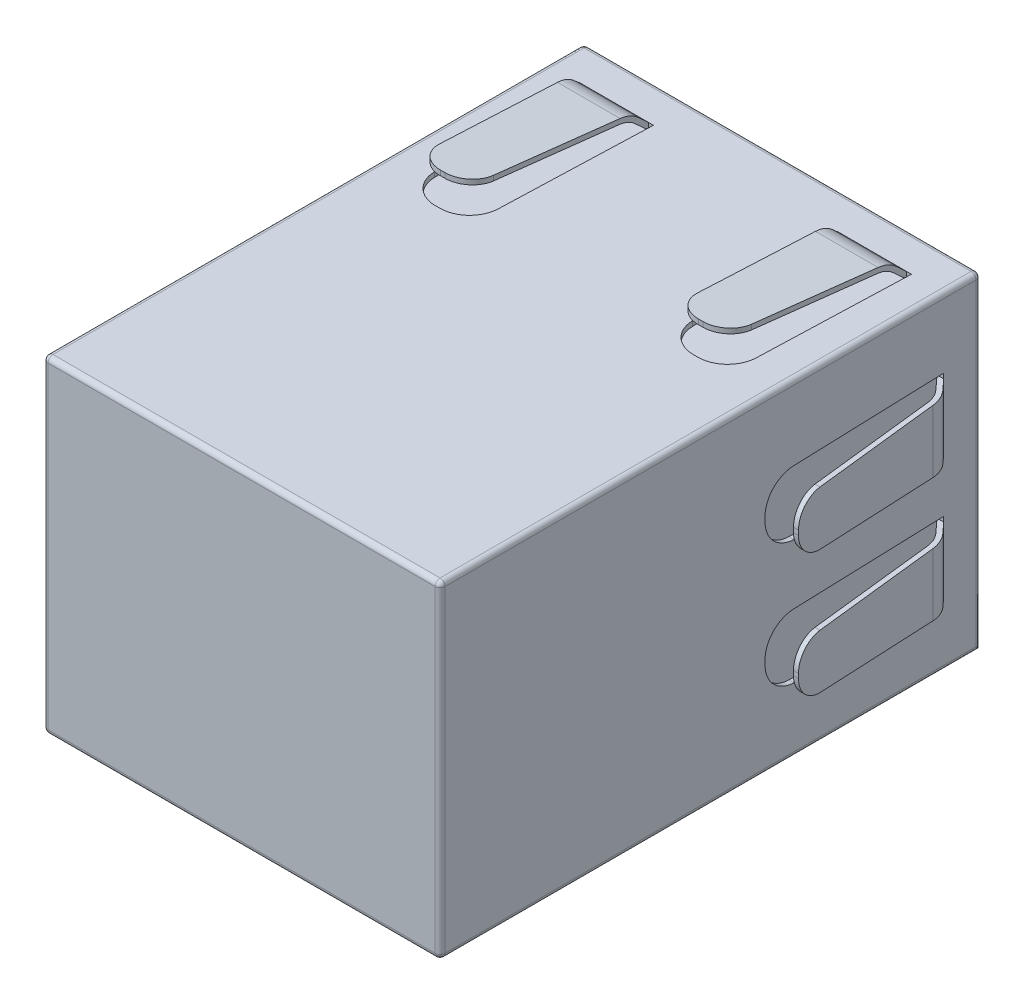
from build123d import *

# Parameters (mm, degrees)
CROQUIS1_W                 = 16
CROQUIS1_H                 = 13.2
EXTRUIR1_DEPTH             = 21.8
CORTAR_EXTRUIR1_DEPTH      = 0.2
CORTAR_EXTRUIR2_DEPTH      = 21.4
VACIADO1_START             = 0.2
VACIADO1_DEPTH             = 21.4
CROQUIS4_W                 = 0.2
CROQUIS4_H                 = 2
EXTRUIR2_DEPTH             = 3.2
CORTAR_EXTRUIR3_DEPTH      = 3.2
REDONDEO2_R                = 0.2
REDONDEO3_R                = 0.5
REDONDEO4_R                = 0.1
REDONDEO5_R                = 0.1
CROQUIS6_W                 = 0.509360806
CROQUIS6_H                 = 2.2
CORTAR_EXTRUIR4_DEPTH      = 3.2
CORTAR_EXTRUIR5_DEPTH      = 3.2
EXTRUIR3_DEPTH             = 3.2
EXTRUIR3_DEPTH_BACK        = 3.2
CORTAR_EXTRUIR6_DEPTH      = 3.2
CORTAR_EXTRUIR6_DEPTH_BACK = 3.2
CORTAR_EXTRUIR7_DEPTH      = 0.2
EXTRUIR4_DEPTH             = 3.2
EXTRUIR4_DEPTH_BACK        = 3.2
CORTAR_EXTRUIR8_DEPTH      = 3.2
CORTAR_EXTRUIR8_DEPTH_BACK = 3.2
MATRIZL1_COUNT             = 2
MATRIZL1_PITCH             = 5
EXTRUIR5_REACH             = 29.497
CROQUIS15_W                = 12.8
CROQUIS15_H                = 10.4
EXTRUIR6_DEPTH             = 9.6
CROQUIS16_W                = 3.295432671
CROQUIS16_H                = 2.190410628
EXTRUIR7_DEPTH             = 8.2
EXTRUIR8_DEPTH             = 4.2
EXTRUIR8_DEPTH_BACK        = 4.2
CROQUIS18_W                = 0.56
CROQUIS18_H                = 7.430160098
CORTAR_EXTRUIR9_DEPTH      = 23.2


# Read off the part's stored shape, not the designer's step: Vaciado1
with BuildPart() as part:
    # Croquis1 → Extruir1 (new body)
    with BuildSketch(Plane.XY):
        with Locations((0, 6.6)):
            Rectangle(CROQUIS1_W, CROQUIS1_H)
    extrude(amount=EXTRUIR1_DEPTH)

    # Croquis2 → Cortar-Extruir1 (cut)
    with BuildSketch(Plane(origin=(0, 0, 0), x_dir=(-1, 0, 0), z_dir=(0, 0, -1))):
        Polygon((-6.4, 10.6), (6.4, 10.6), (6.4, 1.6), (2.5, 1.6), (2.5, -0.56107677), (-2.5, -0.56107677), (-2.5, 1.6), (-6.4, 1.6), align=None)
    extrude(amount=-CORTAR_EXTRUIR1_DEPTH, mode=Mode.SUBTRACT)

    # Croquis3 → Cortar-Extruir2 (cut)
    with BuildSketch(Plane(origin=(0, 0, 0.2), x_dir=(-1, 0, 0), z_dir=(0, 0, -1))):
        Polygon((-2.5, 0.2), (2.5, 0.2), (2.5, 1.6), (6.4, 1.6), (6.4, 10.6), (-6.4, 10.6), (-6.4, 1.6), (-2.5, 1.6), align=None)
    extrude(amount=-CORTAR_EXTRUIR2_DEPTH, mode=Mode.SUBTRACT)

    # Vaciado1 outline → Vaciado1 (cut)
    with BuildSketch(Plane.XY.offset(VACIADO1_START)):
        Polygon((-7.8, 13), (-7.8, 0.2), (-2.5, 0.2), (-2.5, 1.6), (-6.4, 1.6), (-6.4, 10.6), (6.4, 10.6), (6.4, 1.6), (2.5, 1.6), (2.5, 0.2), (7.8, 0.2), (7.8, 13), align=None)
    extrude(amount=VACIADO1_DEPTH, mode=Mode.SUBTRACT)

    # Croquis5 → Cortar-Extruir3 (cut)
    with BuildSketch(Plane(origin=(0, 0, 0), x_dir=(-1, 0, 0), z_dir=(0, 0, -1))):
        with BuildLine():
            Line((-6.459745846, 8.353925027), (-6.316002889, 8.353925027))
            Line((-6.316002889, 8.353925027), (-6.316002889, 8.2))
            Line((-6.316002889, 8.2), (-6.459745846, 8.2))
            ThreePointArc((-6.459745846, 8.2), (-6.536708359, 8.276962513), (-6.459745846, 8.353925027))
        make_face()
        with BuildLine():
            Line((-6.316002889, 6.2), (-6.459745846, 6.2))
            ThreePointArc((-6.459745846, 6.2), (-6.536708359, 6.123037487), (-6.459745846, 6.046074973))
            Line((-6.459745846, 6.046074973), (-6.316002889, 6.046074973))
            Line((-6.316002889, 6.046074973), (-6.316002889, 6.2))
        make_face()
        with BuildLine():
            Line((6.459745846, 6.046074973), (6.316002889, 6.046074973))
            Line((6.316002889, 6.046074973), (6.316002889, 6.2))
            Line((6.316002889, 6.2), (6.459745846, 6.2))
            ThreePointArc((6.459745846, 6.2), (6.536708359, 6.123037487), (6.459745846, 6.046074973))
        make_face()
        with BuildLine():
            Line((6.316002889, 8.2), (6.459745846, 8.2))
            ThreePointArc((6.459745846, 8.2), (6.536708359, 8.276962513), (6.459745846, 8.353925027))
            Line((6.459745846, 8.353925027), (6.316002889, 8.353925027))
            Line((6.316002889, 8.353925027), (6.316002889, 8.2))
        make_face()
    extrude(amount=-CORTAR_EXTRUIR3_DEPTH, mode=Mode.SUBTRACT)


with BuildPart() as body_2:
    # Croquis4 → Extruir2 (new body)
    with BuildSketch(Plane(origin=(0, 0, 0), x_dir=(-1, 0, 0), z_dir=(0, 0, -1))):
        with Locations((-6.5, 7.2)):
            Rectangle(CROQUIS4_W, CROQUIS4_H)
    extrude(amount=-EXTRUIR2_DEPTH)


with BuildPart() as body_3:
    # Simetría1: mirrored copy
    add(body_2.part.mirror(Plane(origin=(0, 0, 0), x_dir=(0, 0, 1), z_dir=(1, 0, 0))))


with BuildPart() as part_1:
    add(part.part)

    # Combinar1: union body 2, body 3
    add(body_2.part)
    add(body_3.part)

    # Redondeo2
    redondeo2_edges = [part_1.edges().sort_by_distance(p)[0] for p in [
        (8, 6.6, 21.8),
        (0, 13.2, 21.8),
        (-8, 6.6, 21.8),
        (0, 13.2, 0),
        (8, 6.6, 0),
        (-8, 6.6, 0),
        (0, 0, 21.8),
        (-8, 13.2, 10.9),
        (8, 13.2, 10.9),
        (8, 0, 10.9),
        (-8, 0, 10.9),
    ]]
    fillet(redondeo2_edges, radius=REDONDEO2_R)

    # Redondeo3
    redondeo3_edges = [part_1.edges().sort_by_distance(p)[0] for p in [
        (6.4, 10.6, 0.1),
        (-6.4, 10.6, 0.1),
    ]]
    fillet(redondeo3_edges, radius=REDONDEO3_R)

    # Redondeo4
    redondeo4_edges = [part_1.edges().sort_by_distance(p)[0] for p in [
        (6.4, 7.2, 0),
    ]]
    fillet(redondeo4_edges, radius=REDONDEO4_R)

    # Redondeo5
    redondeo5_edges = [part_1.edges().sort_by_distance(p)[0] for p in [
        (-6.4, 7.2, 0),
    ]]
    fillet(redondeo5_edges, radius=REDONDEO5_R)

    # Croquis6 → Cortar-Extruir4 (cut)
    with BuildSketch(Plane(origin=(0, 0, 0), x_dir=(-1, 0, 0), z_dir=(0, 0, -1))):
        with Locations((6.367010081, 2.914689266)):
            Rectangle(CROQUIS6_W, CROQUIS6_H)
        with Locations((-6.367010081, 2.914689266)):
            Rectangle(CROQUIS6_W, CROQUIS6_H)
    extrude(amount=-CORTAR_EXTRUIR4_DEPTH, mode=Mode.SUBTRACT)

    # Croquis7 → Cortar-Extruir5 (cut)
    with BuildSketch(Plane(origin=(0, 13.2, 0), x_dir=(1, 0, 0), z_dir=(0, 1, 0))):
        with BuildLine():
            Line((3.7, -1.5), (6.7, -1.5))
            Line((6.7, -1.5), (6.490220779, -7.541641572))
            ThreePointArc((6.490220779, -7.541641572), (6.124619135, -8.363125103), (5.290943505, -8.7))
            Line((5.290943505, -8.7), (5.109056495, -8.7))
            ThreePointArc((5.109056495, -8.7), (4.275380865, -8.363125103), (3.909779221, -7.541641572))
            Line((3.909779221, -7.541641572), (3.7, -1.5))
        make_face()
        with BuildLine():
            Line((-3.909779221, -7.541641572), (-3.7, -1.5))
            Line((-3.7, -1.5), (-6.7, -1.5))
            Line((-6.7, -1.5), (-6.490220779, -7.541641572))
            ThreePointArc((-6.490220779, -7.541641572), (-6.124619135, -8.363125103), (-5.290943505, -8.7))
            Line((-5.290943505, -8.7), (-5.109056495, -8.7))
            ThreePointArc((-5.109056495, -8.7), (-4.275380865, -8.363125103), (-3.909779221, -7.541641572))
        make_face()
    extrude(amount=-CORTAR_EXTRUIR5_DEPTH, mode=Mode.SUBTRACT)

    # Croquis10 → Cortar-Extruir7 (cut)
    with BuildSketch(Plane.ZY.offset(8)):
        with BuildLine():
            Line((7.565929412, 10.189377451), (1.5, 10.4))
            Line((1.5, 10.4), (1.5, 7.400246435))
            Line((1.5, 7.400246435), (7.541641572, 7.610025656))
            ThreePointArc((7.541641572, 7.610025656), (8.363125103, 7.975627299), (8.7, 8.80930293))
            Line((8.7, 8.80930293), (8.7, 8.99118994))
            ThreePointArc((8.7, 8.99118994), (8.371526045, 9.816079237), (7.565929412, 10.189377451))
        make_face()
        with BuildLine():
            Line((1.5, 2.400246435), (7.541641572, 2.610025656))
            ThreePointArc((7.541641572, 2.610025656), (8.363125103, 2.975627299), (8.7, 3.80930293))
            Line((8.7, 3.80930293), (8.7, 3.99118994))
            ThreePointArc((8.7, 3.99118994), (8.371526045, 4.816079237), (7.565929412, 5.189377451))
            Line((7.565929412, 5.189377451), (1.5, 5.4))
            Line((1.5, 5.4), (1.5, 2.400246435))
        make_face()
    cortar_extruir7 = extrude(amount=-CORTAR_EXTRUIR7_DEPTH, mode=Mode.SUBTRACT)

    # Simetría5: Cortar-Extruir7 across plane
    add(cortar_extruir7.mirror(Plane(origin=(0, 0, 0), x_dir=(0, 0, 1), z_dir=(1, 0, 0))), mode=Mode.SUBTRACT)


with BuildPart() as body_2_2:
    # Croquis8 → Extruir3 (new, two sides: drawn at the far end of the back side and taken through both)
    with BuildSketch(Plane(origin=(-5.2, 0, 0), x_dir=(0, 0, -1), z_dir=(1, 0, 0)).offset(-EXTRUIR3_DEPTH_BACK)):
        with BuildLine():
            Line((-1.5, 13.2), (-1.89082011, 13.558378425))
            ThreePointArc((-1.89082011, 13.558378425), (-2.221944414, 13.773797618), (-2.605074233, 13.870027939))
            Line((-2.605074233, 13.870027939), (-9.155528903, 14.4))
            Line((-9.155528903, 14.4), (-9.171657432, 14.200651384))
            Line((-9.171657432, 14.200651384), (-2.621202762, 13.670679324))
            ThreePointArc((-2.621202762, 13.670679324), (-2.301927913, 13.590487389), (-2.025990992, 13.410971395))
            Line((-2.025990992, 13.410971395), (-1.635170883, 13.05259297))
            ThreePointArc((-1.635170883, 13.05259297), (-1.572661019, 13.013251579), (-1.5, 13))
            Line((-1.5, 13), (-1.5, 13.2))
        make_face()
    extrude(amount=EXTRUIR3_DEPTH + EXTRUIR3_DEPTH_BACK)

    # Croquis9 → Cortar-Extruir6 (cut, two sides: drawn at the far end of the back side and taken through both)
    with BuildSketch(Plane(origin=(0, 13.2, 0), x_dir=(1, 0, 0), z_dir=(0, 1, 0)).offset(-CORTAR_EXTRUIR6_DEPTH_BACK)):
        with BuildLine():
            Line((-6.500120454, -1.493059738), (-6.290341233, -7.53470131))
            ThreePointArc((-6.290341233, -7.53470131), (-5.985673197, -8.219270919), (-5.290943505, -8.5))
            Line((-5.290943505, -8.5), (-5.109056495, -8.5))
            ThreePointArc((-5.109056495, -8.5), (-4.414326803, -8.219270919), (-4.109658767, -7.53470131))
            Line((-4.109658767, -7.53470131), (-3.899879546, -1.493059738))
            Line((-3.899879546, -1.493059738), (-3.899879546, -0.922429284))
            Line((-3.899879546, -0.922429284), (-1.369874441, -0.922429284))
            Line((-1.369874441, -0.922429284), (-1.369874441, -9.926026398))
            Line((-1.369874441, -9.926026398), (-8.876769697, -9.926026398))
            Line((-8.876769697, -9.926026398), (-8.876769697, -0.922429284))
            Line((-8.876769697, -0.922429284), (-6.500120454, -0.922429284))
            Line((-6.500120454, -0.922429284), (-6.500120454, -1.493059738))
        make_face()
    extrude(amount=CORTAR_EXTRUIR6_DEPTH + CORTAR_EXTRUIR6_DEPTH_BACK, mode=Mode.SUBTRACT)


with BuildPart() as body_3_2:
    # Simetría3: mirrored copy
    add(body_2_2.part.mirror(Plane(origin=(0, 0, 0), x_dir=(0, 0, 1), z_dir=(1, 0, 0))))


with BuildPart() as body_4:
    # Croquis11 → Extruir4 (new, two sides: drawn at the far end of the back side and taken through both)
    with BuildSketch(Plane(origin=(0, 8.900123217, 0), x_dir=(-1, 0, 0), z_dir=(0, 1, 0)).offset(-EXTRUIR4_DEPTH_BACK)):
        with BuildLine():
            Line((8, 1.5), (8.358378425, 1.89082011))
            ThreePointArc((8.358378425, 1.89082011), (8.573797618, 2.221944414), (8.670027939, 2.605074233))
            Line((8.670027939, 2.605074233), (9.2, 9.155528903))
            Line((9.2, 9.155528903), (9.000651384, 9.171657432))
            Line((9.000651384, 9.171657432), (8.470679324, 2.621202762))
            ThreePointArc((8.470679324, 2.621202762), (8.390487389, 2.301927913), (8.210971395, 2.025990992))
            Line((8.210971395, 2.025990992), (7.85259297, 1.635170883))
            ThreePointArc((7.85259297, 1.635170883), (7.813251579, 1.572661019), (7.8, 1.5))
            Line((7.8, 1.5), (8, 1.5))
        make_face()
    extrude(amount=EXTRUIR4_DEPTH + EXTRUIR4_DEPTH_BACK)

    # Croquis13 → Cortar-Extruir8 (cut, two sides: drawn at the far end of the back side and taken through both)
    with BuildSketch(Plane.ZY.offset(8).offset(-CORTAR_EXTRUIR8_DEPTH_BACK)):
        with BuildLine():
            Line((1.493059738, 10.200120454), (7.556872001, 9.989571417))
            ThreePointArc((7.556872001, 9.989571417), (8.226936036, 9.677895116), (8.5, 8.99118994))
            Line((8.5, 8.99118994), (8.5, 8.80930293))
            ThreePointArc((8.5, 8.80930293), (8.219270919, 8.114573238), (7.53470131, 7.809905201))
            Line((7.53470131, 7.809905201), (1.493059738, 7.60012598))
            Line((1.493059738, 7.60012598), (0.86073748, 7.60012598))
            Line((0.86073748, 7.60012598), (0.86073748, 5.206069351))
            Line((0.86073748, 5.206069351), (9.657096721, 5.206069351))
            Line((9.657096721, 5.206069351), (9.657096721, 12.437577622))
            Line((9.657096721, 12.437577622), (0.86073748, 12.437577622))
            Line((0.86073748, 12.437577622), (0.86073748, 10.200120454))
            Line((0.86073748, 10.200120454), (1.493059738, 10.200120454))
        make_face()
    extrude(amount=CORTAR_EXTRUIR8_DEPTH + CORTAR_EXTRUIR8_DEPTH_BACK, mode=Mode.SUBTRACT)


with BuildPart() as matrizl1_1:
    # MatrizL1: pattern copy
    add(body_4.part.moved(Location(Vector(0, -1, 0) * (1 * MATRIZL1_PITCH))))


with BuildPart() as body_6:
    # Simetría4: mirrored copy
    add(matrizl1_1.part.mirror(Plane(origin=(0, 0, 0), x_dir=(0, 0, 1), z_dir=(1, 0, 0))))


with BuildPart() as body_7:
    # Simetr_a4 2: mirrored copy
    add(body_4.part.mirror(Plane(origin=(0, 0, 0), x_dir=(0, 0, 1), z_dir=(1, 0, 0))))


with BuildPart() as body_3_2_1:
    add(body_3_2.part)

    # Combinar2: union body 2 2, part, body 7, body 6, MatrizL1_1, body 4
    add(body_2_2.part)
    add(part_1.part)
    add(body_7.part)
    add(body_6.part)
    add(matrizl1_1.part)
    add(body_4.part)


with BuildPart() as body_2_3:

    # Croquis14 → Extruir5 (new, up to next)
    with BuildSketch(Plane.XY.offset(0.2), mode=Mode.PRIVATE) as extruir5_sk1:
        Polygon((2.5, 0.2), (2.5, 1.6), (6.621690484, 1.6), (6.621690484, 4.014689266), (6.4, 4.014689266), (6.4, 5.890677481), (6.621690484, 5.890677481), (6.621690484, 8.505485775), (6.4, 8.505485775), (6.4, 10.6), (-6.4, 10.6), (-6.4, 8.505485775), (-6.621690484, 8.505485775), (-6.621690484, 5.890677481), (-6.4, 5.890677481), (-6.4, 4.014689266), (-6.621690484, 4.014689266), (-6.621690484, 1.6), (-2.5, 1.6), (-2.5, 0.2), (-7.8, 0.2), (-7.8, 13), (7.8, 13), (7.8, 0.2), align=None)
    extruir5_tool1 = extrude(extruir5_sk1.sketch, amount=EXTRUIR5_REACH, mode=Mode.PRIVATE) - body_3_2_1.part
    add(extruir5_tool1.solids().sort_by_distance((2.701792, 0.9, 0.2))[0])


with BuildPart() as body_3_3:
    # Croquis15 → Extruir6 (new body)
    with BuildSketch(Plane(origin=(0, 0, 12), x_dir=(-1, 0, 0), z_dir=(0, 0, -1))):
        with Locations((0, 5.4)):
            Rectangle(CROQUIS15_W, CROQUIS15_H)
    extrude(amount=-EXTRUIR6_DEPTH)


with BuildPart() as body_4_2:
    # Croquis16 → Extruir7 (new body)
    with BuildSketch(Plane(origin=(0, 0, 0), x_dir=(-1, 0, 0), z_dir=(0, 0, -1))):
        with Locations((-4.752283665, 2.89181563)):
            Rectangle(CROQUIS16_W, CROQUIS16_H)
    extrude(amount=-EXTRUIR7_DEPTH)


with BuildPart() as body_5:
    # Simetría6: mirrored copy
    add(body_4_2.part.mirror(Plane(origin=(0, 0, 0), x_dir=(0, 0, 1), z_dir=(1, 0, 0))))


with BuildPart() as body_6_2:
    # Croquis17 → Extruir8 (new, two sides: drawn at the far end of the back side and taken through both)
    with BuildSketch(Plane(origin=(0, 0, 0), x_dir=(0, 0, -1), z_dir=(1, 0, 0)).offset(-EXTRUIR8_DEPTH_BACK)):
        with BuildLine():
            Line((-3.632461712, 10.6), (-3.915225161, 10.095928339))
            ThreePointArc((-3.915225161, 10.095928339), (-4.229861899, 9.73209012), (-4.662104767, 9.521043609))
            Line((-4.662104767, 9.521043609), (-12.371123666, 7.532709712))
            Line((-12.371123666, 7.532709712), (-12.321173743, 7.339047622))
            Line((-12.321173743, 7.339047622), (-4.612154844, 9.327381519))
            ThreePointArc((-4.612154844, 9.327381519), (-4.107871498, 9.573602448), (-3.740795304, 9.99808037))
            Line((-3.740795304, 9.99808037), (-3.458031855, 10.502152031))
            Line((-3.458031855, 10.502152031), (-3.198562753, 10.964697742))
            Line((-3.198562753, 10.964697742), (-3.632461712, 10.964697742))
            Line((-3.632461712, 10.964697742), (-3.632461712, 10.6))
        make_face()
    extrude(amount=EXTRUIR8_DEPTH + EXTRUIR8_DEPTH_BACK)

    # Croquis18 → Cortar-Extruir9 (cut)
    with BuildSketch(Plane(origin=(0, 0, 0), x_dir=(-1, 0, 0), z_dir=(0, 0, -1))):
        with Locations((-3.36, 10.14554588)):
            Rectangle(CROQUIS18_W, CROQUIS18_H)
        with Locations((-2.24, 10.14554588)):
            Rectangle(CROQUIS18_W, CROQUIS18_H)
        with Locations((-1.12, 10.14554588)):
            Rectangle(CROQUIS18_W, CROQUIS18_H)
        with Locations((0, 10.14554588)):
            Rectangle(CROQUIS18_W, CROQUIS18_H)
        with Locations((1.12, 10.14554588)):
            Rectangle(CROQUIS18_W, CROQUIS18_H)
        with Locations((2.24, 10.14554588)):
            Rectangle(CROQUIS18_W, CROQUIS18_H)
        with Locations((3.36, 10.14554588)):
            Rectangle(CROQUIS18_W, CROQUIS18_H)
    extrude(amount=-CORTAR_EXTRUIR9_DEPTH, mode=Mode.SUBTRACT)


with BuildPart() as cortar_extruir9_piece_1:
    # of the separate pieces the step leaves, piece 1, a body of its own (cortar_extruir9_pieces)
    add(body_6_2.part.solids().sort_by_distance((4.2, 10.095928339, 3.915225161))[0])


with BuildPart() as cortar_extruir9_piece_2:
    # of the separate pieces the step leaves, piece 2, a body of its own (cortar_extruir9_pieces)
    add(body_6_2.part.solids().sort_by_distance((-1.4, 10.095928339, 3.915225161))[0])


with BuildPart() as cortar_extruir9_piece_3:
    # of the separate pieces the step leaves, piece 3, a body of its own (cortar_extruir9_pieces)
    add(body_6_2.part.solids().sort_by_distance((1.96, 10.095928339, 3.915225161))[0])


with BuildPart() as cortar_extruir9_piece_4:
    # of the separate pieces the step leaves, piece 4, a body of its own (cortar_extruir9_pieces)
    add(body_6_2.part.solids().sort_by_distance((-0.28, 10.095928339, 3.915225161))[0])


with BuildPart() as cortar_extruir9_piece_5:
    # of the separate pieces the step leaves, piece 5, a body of its own (cortar_extruir9_pieces)
    add(body_6_2.part.solids().sort_by_distance((0.84, 10.095928339, 3.915225161))[0])


with BuildPart() as cortar_extruir9_piece_6:
    # of the separate pieces the step leaves, piece 6, a body of its own (cortar_extruir9_pieces)
    add(body_6_2.part.solids().sort_by_distance((3.08, 10.095928339, 3.915225161))[0])


with BuildPart() as cortar_extruir9_piece_7:
    # of the separate pieces the step leaves, piece 7, a body of its own (cortar_extruir9_pieces)
    add(body_6_2.part.solids().sort_by_distance((-2.52, 10.095928339, 3.915225161))[0])


with BuildPart() as cortar_extruir9_piece_8:
    # of the separate pieces the step leaves, piece 8, a body of its own (cortar_extruir9_pieces)
    add(body_6_2.part.solids().sort_by_distance((-3.64, 10.095928339, 3.915225161))[0])


solid = Compound([body_3_2_1.part, body_2_3.part, body_3_3.part, body_4_2.part, body_5.part, cortar_extruir9_piece_1.part, cortar_extruir9_piece_2.part, cortar_extruir9_piece_3.part, cortar_extruir9_piece_4.part, cortar_extruir9_piece_5.part, cortar_extruir9_piece_6.part, cortar_extruir9_piece_7.part, cortar_extruir9_piece_8.part])
